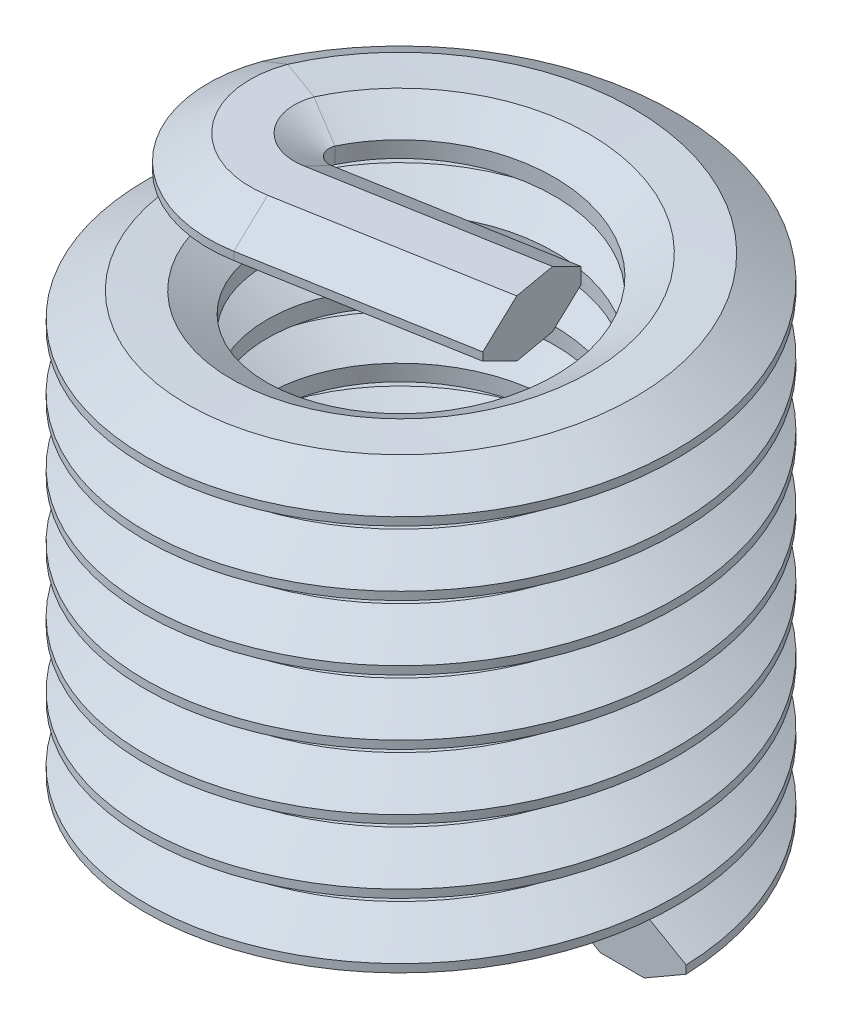
from build123d import *

# Parameters (mm, degrees)
SWEEP1_PITCH       = 0.45
SWEEP1_HEIGHT      = 3.35
SWEEP1_RADIUS      = 1.25
SWEEP1_START_ANGLE = 90
REVOLVE1_ANGLE     = 120
EXTRUDE1_DEPTH     = 1.5


with BuildPart() as part:
    # Sweep1: sweep along a helix
    with BuildLine() as sweep1_path:
        add(Helix(SWEEP1_PITCH, SWEEP1_HEIGHT, SWEEP1_RADIUS, center=(0, 0, 0), direction=(0, 1, 0), mode=Mode.PRIVATE).rotate(Axis((0, 0, 0), (0, 1, 0)), SWEEP1_START_ANGLE))
    # Sketch1 → Sweep1 (sweep)
    with BuildSketch(Plane(origin=(0, 0, 0), x_dir=(-1, 0, 0), z_dir=(0, 0, 1))):
        Polygon((-1.85, -0.028125), (-1.557716426, -0.196875), (-1.25, -0.196875), (-1.006430355, -0.05625), (-1.006430355, 0.05625), (-1.25, 0.196875), (-1.557716426, 0.196875), (-1.85, 0.028125), align=None)
    sweep(path=sweep1_path.line, is_frenet=True)


with BuildPart() as body_2:
    # Sketch3 → Revolve1 (revolve)
    with BuildSketch(Plane(origin=(1.4304e-05, 0, -3.93e-05), x_dir=(0.9396938444780639, 0, 0.3420167812403893), z_dir=(-0.3420167812403893, 0, 0.9396938444780639))):
        Polygon((-1.249999999, 3.1536463), (-1.006430354, 3.294270808), (-1.006430355, 3.4067713), (-1.25, 3.547397115), (-1.557716426, 3.54739778), (-1.85, 3.37864778), (-1.85, 3.322397439), (-1.557716426, 3.153647115), align=None)
    revolve(axis=Axis((-0.854169452, 3.350520793, -0.310933301), (-1.9526713832506746e-09, 1.0, -7.107063563613301e-10)), revolution_arc=REVOLVE1_ANGLE)

    # Sketch4 → Extrude1 (add)
    with BuildSketch(Plane(origin=(-0.775238269, -1e-09, 0.136698283), x_dir=(-0.1736517011642743, -1.3875082015216864e-08, -0.9848071317180607), z_dir=(0.9848071317180607, 1.7995890067044342e-09, -0.17365170116427434))):
        Polygon((-0.194176977, 3.153647116), (0.11353945, 3.153646304), (0.357109093, 3.294270815), (0.357109092, 3.406771307), (0.113539445, 3.547397119), (-0.194176981, 3.547397781), (-0.486460553, 3.378647778), (-0.486460552, 3.322397436), align=None)
    extrude(amount=EXTRUDE1_DEPTH)


solid = Compound([part.part, body_2.part])
